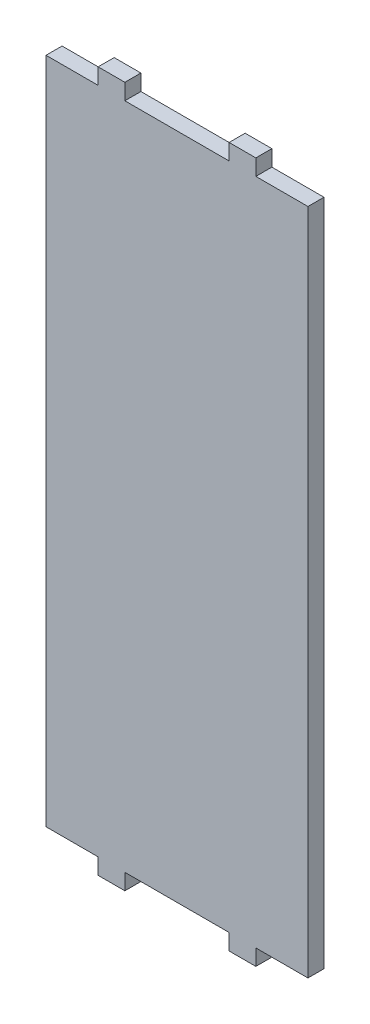
from build123d import *

# Parameters (mm, degrees)
ESQUISSE1_W        = 98
ESQUISSE1_H        = 250
BOSS_EXTRU_1_DEPTH = 6
ESQUISSE2_W        = 10
ESQUISSE2_H        = 6
BOSS_EXTRU_2_DEPTH = 6


with BuildPart() as part:
    # Esquisse1 → Boss.-Extru.1 (new body)
    with BuildSketch(Plane.XY):
        Rectangle(ESQUISSE1_W, ESQUISSE1_H)
    extrude(amount=BOSS_EXTRU_1_DEPTH)

    # Esquisse2 → Boss.-Extru.2 (add)
    with BuildSketch(Plane.XY.offset(6)):
        with Locations((24.5, -128)):
            Rectangle(ESQUISSE2_W, ESQUISSE2_H)
        with Locations((-24.5, -128)):
            Rectangle(ESQUISSE2_W, ESQUISSE2_H)
        with Locations((-24.5, 128)):
            Rectangle(ESQUISSE2_W, ESQUISSE2_H)
        with Locations((24.5, 128)):
            Rectangle(ESQUISSE2_W, ESQUISSE2_H)
    extrude(amount=-BOSS_EXTRU_2_DEPTH)


solid = part.part
